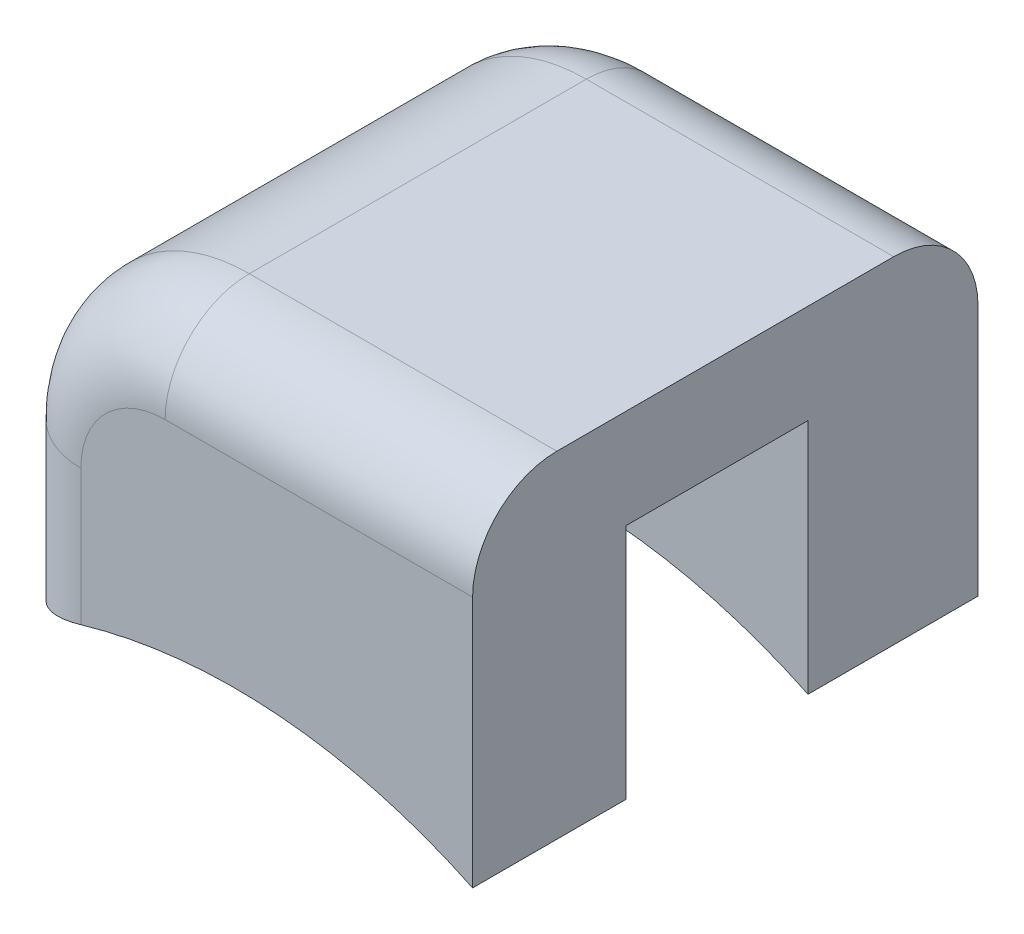
from build123d import *

# Parameters (mm, degrees)
SKETCH1_W                      = 60
SKETCH1_H                      = 60
BOSS_EXTRUDE1_DEPTH            = 40
SKETCH2_R                      = 65
CUT_EXTRUDE1_DEPTH             = 82.241203775
CAVITY1_START                  = -9.816541319
CAVITY1_DEPTH                  = 21.6
SKETCH3_W                      = 21.6
SKETCH3_H                      = 10.847854466
CUT_EXTRUDE2_DEPTH             = 10
SKETCH4_W                      = 60
SKETCH4_H                      = 40
CUT_EXTRUDE3_DEPTH             = 2.5
SKETCH5_W                      = 60
SKETCH5_H                      = 40
CUT_EXTRUDE4_DEPTH             = 1
FILLET1_R                      = 20
FILLET2_R                      = 10
SKETCH6_W                      = 16.032155739
SKETCH6_H                      = 21.6
CUT_EXTRUDE5_DEPTH             = 58.845323025
CUT_EXTRUDE5_DIRECTION_2_REACH = 59.845


# Read off the part's stored shape, not the designer's step: Cavity1
with BuildPart() as part:
    # Sketch1 → Boss-Extrude1 (new body)
    with BuildSketch(Plane(origin=(0, 0, 0), x_dir=(1, 0, 0), z_dir=(0, 1, 0))):
        with Locations((7.418353663, 0)):
            Rectangle(SKETCH1_W, SKETCH1_H)
    extrude(amount=BOSS_EXTRUDE1_DEPTH)

    # Sketch2 → Cut-Extrude1 (cut, through all)
    with BuildSketch(Plane.XY.offset(30)):
        with Locations((8.211917099, -58.463187122)):
            Circle(SKETCH2_R)
    extrude(amount=-CUT_EXTRUDE1_DEPTH, mode=Mode.SUBTRACT)

    # Cavity1 outline → Cavity1 (cut)
    with BuildSketch(Plane.XY.offset(CAVITY1_START)):
        with BuildLine():
            Line((37.418353663, 28.401179965), (19.900272044, 25.583077508))
            Line((19.900272044, 25.583077508), (10.402665556, 28.20897422))
            Line((10.402665556, 28.20897422), (11.046955399, 30.539306317))
            Line((11.046955399, 30.539306317), (8.306376045, 31.297021255))
            Line((8.306376045, 31.297021255), (6.40567059, 24.42235921))
            Line((6.40567059, 24.42235921), (0.254542205, 23.221419402))
            ThreePointArc((0.254542205, 23.221419402), (-2.379423034, 21.883873023), (-3.91543957, 19.360491087))
            Line((-3.91543957, 19.360491087), (-6.809482783, 8.89302545))
            ThreePointArc((-6.809482783, 8.89302545), (-6.970209101, 6.844246899), (-6.353840253, 4.883783703))
            ThreePointArc((-6.353840253, 4.883783703), (14.742582186, 6.207906989), (35.148358053, 0.692777486))
            Line((35.148358053, 0.692777486), (37.418353663, 2.423285883))
            Line((37.418353663, 2.423285883), (37.418353663, 28.401179965))
        make_face()
    extrude(amount=CAVITY1_DEPTH, mode=Mode.SUBTRACT)

    # Sketch3 → Cut-Extrude2 (cut)
    with BuildSketch(Plane(origin=(37.418353663, 0, 0), x_dir=(0, 0, -1), z_dir=(1, 0, 0))):
        with Locations((-0.983458681, 5.423927233)):
            Rectangle(SKETCH3_W, SKETCH3_H)
    extrude(amount=-CUT_EXTRUDE2_DEPTH, mode=Mode.SUBTRACT)

    # Sketch4 → Cut-Extrude3 (cut)
    with BuildSketch(Plane.ZY.offset(22.581646337)):
        with Locations((0, 20)):
            Rectangle(SKETCH4_W, SKETCH4_H)
    extrude(amount=-CUT_EXTRUDE3_DEPTH, mode=Mode.SUBTRACT)

    # Sketch5 → Cut-Extrude4 (cut)
    with BuildSketch(Plane(origin=(37.418353663, 0, 0), x_dir=(0, 0, -1), z_dir=(1, 0, 0))):
        with Locations((0, 20)):
            Rectangle(SKETCH5_W, SKETCH5_H)
    extrude(amount=-CUT_EXTRUDE4_DEPTH, mode=Mode.SUBTRACT)

    # Fillet1
    fillet1_edges = [part.edges().sort_by_distance(p)[0] for p in [
        (-20.081646337, 40, 0),
    ]]
    fillet(fillet1_edges, radius=FILLET1_R)

    # Fillet2
    fillet2_edges = [part.edges().sort_by_distance(p)[0] for p in [
        (-20.081646337, 10.027910314, 30),
        (18.168353663, 40, -30),
        (-20.081646337, 10.027910314, -30),
        (-14.22378196, 34.142135624, -30),
        (18.168353663, 40, 30),
        (-14.22378196, 34.142135624, 30),
    ]]
    fillet(fillet2_edges, radius=FILLET2_R)

    # Sketch6 → Cut-Extrude5 (cut)
    with BuildSketch(Plane(origin=(0, 6.536812878, 0), x_dir=(-1, 0, 0), z_dir=(0, -1, 0))):
        with Locations((-1.011330106, -0.983458681)):
            Rectangle(SKETCH6_W, SKETCH6_H)
    extrude(amount=CUT_EXTRUDE5_DEPTH, mode=Mode.SUBTRACT)

    # Sketch6 → Cut-Extrude5 direction 2 (cut, up to next)
    with BuildSketch(Plane(origin=(0, 6.536812878, 0), x_dir=(-1, 0, 0), z_dir=(0, -1, 0)), mode=Mode.PRIVATE) as cut_extrude5_direction_2_sk1:
        with Locations((-1.011330106, -0.983458681)):
            Rectangle(SKETCH6_W, SKETCH6_H)
    cut_extrude5_direction_2_tool1 = extrude(cut_extrude5_direction_2_sk1.sketch, amount=-CUT_EXTRUDE5_DIRECTION_2_REACH, mode=Mode.PRIVATE) & part.part
    add(cut_extrude5_direction_2_tool1.solids().sort_by_distance((1.01133, 6.536813, 0.983459))[0], mode=Mode.SUBTRACT)


solid = part.part
